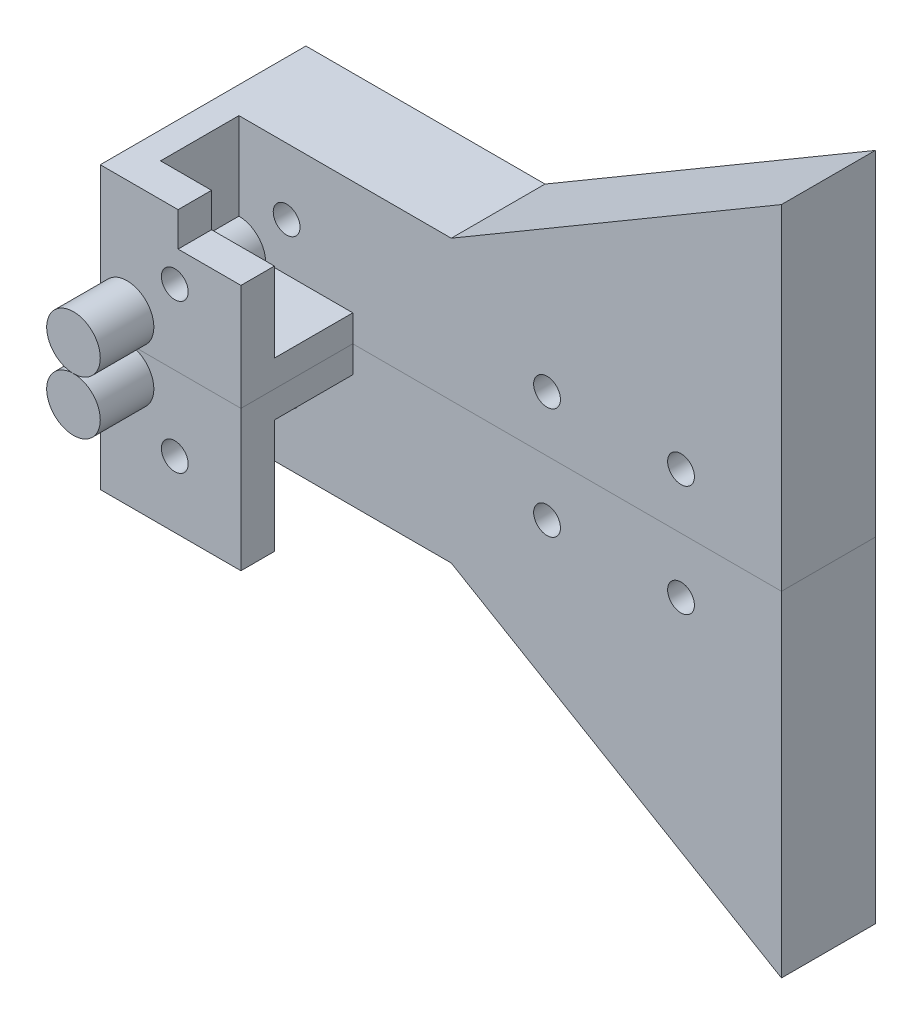
from build123d import *
from build123d.topology import SkipClean

# Parameters (mm, degrees)
BOSS_EXTRUDE1_DEPTH     = 11.7
BOSS_EXTRUDE4_START     = 8
SKETCH1_6_R             = 4
BOSS_EXTRUDE4_DEPTH     = 8
BOSS_EXTRUDE5_START     = -11.7
SKETCH1_7_R             = 2
BOSS_EXTRUDE5_DEPTH     = 4
BOSS_EXTRUDE6_START     = 5
SKETCH1_8_R             = 2
BOSS_EXTRUDE6_DEPTH     = 5
BOSS_EXTRUDE7_START     = 8
BOSS_EXTRUDE7_OUTLINE_R = 4
BOSS_EXTRUDE7_DEPTH     = 5
SKETCH2_W               = 7
SKETCH2_H               = 10
SKETCH2_H_2             = 7
SKETCH2_W_2             = 10
BOSS_EXTRUDE8_DEPTH     = 5
BOSS_EXTRUDE9_START     = -20.7
SKETCH2_3_W             = 7
SKETCH2_3_H             = 10
SKETCH2_3_W_2           = 10
SKETCH2_3_H_2           = 7
BOSS_EXTRUDE9_DEPTH     = 4
SKETCH4_R               = 2
BOSS_EXTRUDE11_DEPTH    = 10
BOSS_EXTRUDE12_START    = -4
SKETCH4_3_R             = 2
BOSS_EXTRUDE12_DEPTH    = 4
SKETCH4_4_R             = 2
BOSS_EXTRUDE13_DEPTH    = 10
CUT_EXTRUDE1_DEPTH      = 4.5
SKETCH6_W               = 9.384536498
SKETCH6_H               = 5.1
CUT_EXTRUDE2_DEPTH      = 10


# Read off the part's stored shape, not the designer's step: Boss-Extrude7
with BuildPart() as part:
    # Sketch1 → Boss-Extrude1 (new body)
    with BuildSketch(Plane.XY):
        with BuildLine():
            Line((-36, -4), (-29, -4))
            Line((-29, -4), (-29, 0))
            Line((-29, 0), (-46, 0))
            ThreePointArc((-46, 0), (-43.171572875, -1.171572875), (-42, -4))
            Line((-42, -4), (-36, -4))
        make_face()
        with BuildLine():
            ThreePointArc((-46, -8), (-43.171572875, -6.828427125), (-42, -4))
            Line((-42, -4), (-46, -4))
            Line((-46, -4), (-46, -8))
        make_face()
        with BuildLine():
            Line((-46, -4), (-42, -4))
            ThreePointArc((-42, -4), (-43.171572875, -1.171572875), (-46, 0))
            Line((-46, 0), (-46, -4))
        make_face()
        with BuildLine():
            Line((-46, -4), (-46, 0))
            ThreePointArc((-46, 0), (-48.828427125, -1.171572875), (-50, -4))
            Line((-50, -4), (-46, -4))
        make_face()
        with BuildLine():
            Line((-46, -8), (-46, -4))
            Line((-46, -4), (-50, -4))
            ThreePointArc((-50, -4), (-48.828427125, -6.828427125), (-46, -8))
        make_face()
        with BuildLine():
            Line((-46, -14), (-46, -8))
            ThreePointArc((-46, -8), (-48.828427125, -6.828427125), (-50, -4))
            Line((-50, -4), (-50, -21))
            Line((-50, -21), (-46, -21))
            Line((-46, -21), (-46, -14))
        make_face()
    extrude(amount=-BOSS_EXTRUDE1_DEPTH)

    # Sketch1<6> → Boss-Extrude4 (add)
    with BuildSketch(Plane.XY.offset(BOSS_EXTRUDE4_START)):
        with Locations((-46, -4)):
            Circle(SKETCH1_6_R)
    extrude(amount=-BOSS_EXTRUDE4_DEPTH)

    # Sketch1<7> → Boss-Extrude5 (add)
    with SkipClean():  # the faces are left unmerged after this step: merging them gives an invalid solid
        with BuildSketch(Plane.XY.offset(BOSS_EXTRUDE5_START)):
            with BuildLine():
                Line((-36, -4), (-29, -4))
                Line((-29, -4), (-29, 0))
                Line((-29, 0), (-46, 0))
                ThreePointArc((-46, 0), (-48.828427125, -1.171572875), (-50, -4))
                Line((-50, -4), (-50, -21))
                Line((-50, -21), (-46, -21))
                Line((-46, -21), (-46, -14))
                Line((-46, -14), (-36, -14))
                Line((-36, -14), (-36, -4))
            make_face()
            with Locations((-38.878679656, -11.121320344)):
                Circle(SKETCH1_7_R, mode=Mode.SUBTRACT)
        extrude(amount=-BOSS_EXTRUDE5_DEPTH)

    # Sketch1<8> → Boss-Extrude6 (add)
    # profile 1 of 3: a face of its own
    with BuildSketch(Plane.XY.offset(BOSS_EXTRUDE6_START)):
        with BuildLine():
            Line((-46, -14), (-46, -8))
            ThreePointArc((-46, -8), (-48.828427125, -6.828427125), (-50, -4))
            Line((-50, -4), (-50, -21))
            Line((-50, -21), (-46, -21))
            Line((-46, -21), (-46, -14))
        make_face()
    # profile 2 of 3: a face of its own
    with BuildSketch(Plane.XY.offset(BOSS_EXTRUDE6_START)):
        with BuildLine():
            Line((-36, -14), (-36, -4))
            Line((-36, -4), (-42, -4))
            ThreePointArc((-42, -4), (-43.171572875, -6.828427125), (-46, -8))
            Line((-46, -8), (-46, -14))
            Line((-46, -14), (-36, -14))
        make_face()
        with Locations((-38.878679656, -11.121320344)):
            Circle(SKETCH1_8_R, mode=Mode.SUBTRACT)
    # profile 3 of 3: a face of its own
    with BuildSketch(Plane.XY.offset(BOSS_EXTRUDE6_START)):
        with BuildLine():
            Line((-36, -4), (-29, -4))
            Line((-29, -4), (-29, 0))
            Line((-29, 0), (-46, 0))
            ThreePointArc((-46, 0), (-43.171572875, -1.171572875), (-42, -4))
            Line((-42, -4), (-36, -4))
        make_face()
    extrude(amount=-BOSS_EXTRUDE6_DEPTH)

    # Boss-Extrude7 outline → Boss-Extrude7 (add)
    with BuildSketch(Plane.XY.offset(BOSS_EXTRUDE7_START)):
        with Locations((-46, -4)):
            Circle(BOSS_EXTRUDE7_OUTLINE_R)
    extrude(amount=BOSS_EXTRUDE7_DEPTH)

    # Sketch2 → Boss-Extrude8 (add)
    with BuildSketch(Plane.XY.offset(5)):
        with Locations((-32.5, -9)):
            Rectangle(SKETCH2_W, SKETCH2_H)
        with Locations((-32.5, -17.5)):
            Rectangle(SKETCH2_W, SKETCH2_H_2)
        with Locations((-41, -17.5)):
            Rectangle(SKETCH2_W_2, SKETCH2_H_2)
    extrude(amount=-BOSS_EXTRUDE8_DEPTH)

    # Sketch2<3> → Boss-Extrude9 (add)
    with BuildSketch(Plane.XY.offset(5).offset(BOSS_EXTRUDE9_START)):
        with Locations((-32.5, -9)):
            Rectangle(SKETCH2_3_W, SKETCH2_3_H)
        with Locations((-41, -17.5)):
            Rectangle(SKETCH2_3_W_2, SKETCH2_3_H_2)
        with Locations((-32.5, -17.5)):
            Rectangle(SKETCH2_3_W, SKETCH2_3_H_2)
    extrude(amount=BOSS_EXTRUDE9_DEPTH)

    # Sketch4 → Boss-Extrude11 (add)
    with SkipClean():  # the faces are left unmerged after this step: merging them gives an invalid solid
        with BuildSketch(Plane(origin=(0, 0, -15.7), x_dir=(-1, 0, 0), z_dir=(0, 0, -1))):
            with BuildLine():
                Line((46, 0), (-35, 0))
                Line((-35, 0), (-35, -50))
                Line((-35, -50), (14.3, -21))
                Line((14.3, -21), (48.503491121, -0.88029934))
                ThreePointArc((48.503491121, -0.88029934), (47.326875533, -0.226486873), (46, 0))
            make_face()
            with Locations(Location((-20, -8.3, 0), (0, 0, 90))):
                Circle(SKETCH4_R, mode=Mode.SUBTRACT)
            with Locations(Location((0, -8.3, 0), (0, 0, 90))):
                Circle(SKETCH4_R, mode=Mode.SUBTRACT)
        extrude(amount=BOSS_EXTRUDE11_DEPTH)

    # Sketch4<3> → Boss-Extrude12 (add)
    with SkipClean():  # the faces are left unmerged after this step: merging them gives an invalid solid
        with BuildSketch(Plane(origin=(0, 0, -15.7), x_dir=(-1, 0, 0), z_dir=(0, 0, -1)).offset(BOSS_EXTRUDE12_START)):
            Polygon((29, 0), (-35, 0), (-35, -50), (14.3, -21), (29, -21), align=None)
            with Locations(Location((-20, -8.3, 0), (0, 0, 90))):
                Circle(SKETCH4_3_R, mode=Mode.SUBTRACT)
            with Locations(Location((0, -8.3, 0), (0, 0, 90))):
                Circle(SKETCH4_3_R, mode=Mode.SUBTRACT)
        extrude(amount=BOSS_EXTRUDE12_DEPTH)

    # Sketch4<4> → Boss-Extrude13 (add)
    # profile 1 of 2: a face of its own
    with SkipClean():  # the faces are left unmerged after this step: merging them gives an invalid solid
        with BuildSketch(Plane(origin=(0, 0, -15.7), x_dir=(-1, 0, 0), z_dir=(0, 0, -1))):
            with BuildLine():
                Line((48.503491121, -0.88029934), (29, -12.352941176))
                Line((29, -12.352941176), (29, -21))
                Line((29, -21), (50, -21))
                Line((50, -21), (50, -4))
                ThreePointArc((50, -4), (49.606519408, -2.269965966), (48.503491121, -0.88029934))
            make_face()
            with Locations(Location((38.878679656, -11.121320344, 0), (0, 0, 90))):
                Circle(SKETCH4_4_R, mode=Mode.SUBTRACT)
        # profile 2 of 2: a face of its own
        with BuildSketch(Plane(origin=(0, 0, -15.7), x_dir=(-1, 0, 0), z_dir=(0, 0, -1))):
            Polygon((29, -21), (29, -12.352941176), (14.3, -21), align=None)
        extrude(amount=BOSS_EXTRUDE13_DEPTH)
    add(part.part.scale(1), mode=Mode.REPLACE)  # the faces are merged on a copy

    # Sketch5 → Cut-Extrude1 (cut)
    with BuildSketch(Plane(origin=(0, 0, -25.7), x_dir=(-1, 0, 0), z_dir=(0, 0, -1))):
        Polygon((35.378679656, -9.100594401), (35.378679656, -13.142046286), (38.878679656, -15.162772228), (42.378679656, -13.142046286), (42.378679656, -9.100594401), (38.878679656, -7.079868459), align=None)
        Polygon((-3.5, -6.279274058), (-3.5, -10.320725942), (0, -12.341451884), (3.5, -10.320725942), (3.5, -6.279274058), (0, -4.258548116), align=None)
        Polygon((-16.5, -10.320725942), (-16.5, -6.279274058), (-20, -4.258548116), (-23.5, -6.279274058), (-23.5, -10.320725942), (-20, -12.341451884), align=None)
    extrude(amount=-CUT_EXTRUDE1_DEPTH, mode=Mode.SUBTRACT)


with BuildPart() as body_2:
    # Mirror2: mirrored copy
    add(part.part.mirror(Plane.ZX))

    # Sketch6 → Cut-Extrude2 (cut)
    with SkipClean():  # the faces are left unmerged after this step: merging them gives an invalid solid
        with BuildSketch(Plane.XY.offset(5)):
            with Locations((-33.692268249, 18.45)):
                Rectangle(SKETCH6_W, SKETCH6_H)
        extrude(amount=-CUT_EXTRUDE2_DEPTH, mode=Mode.SUBTRACT)


solid = Compound([part.part, body_2.part])
